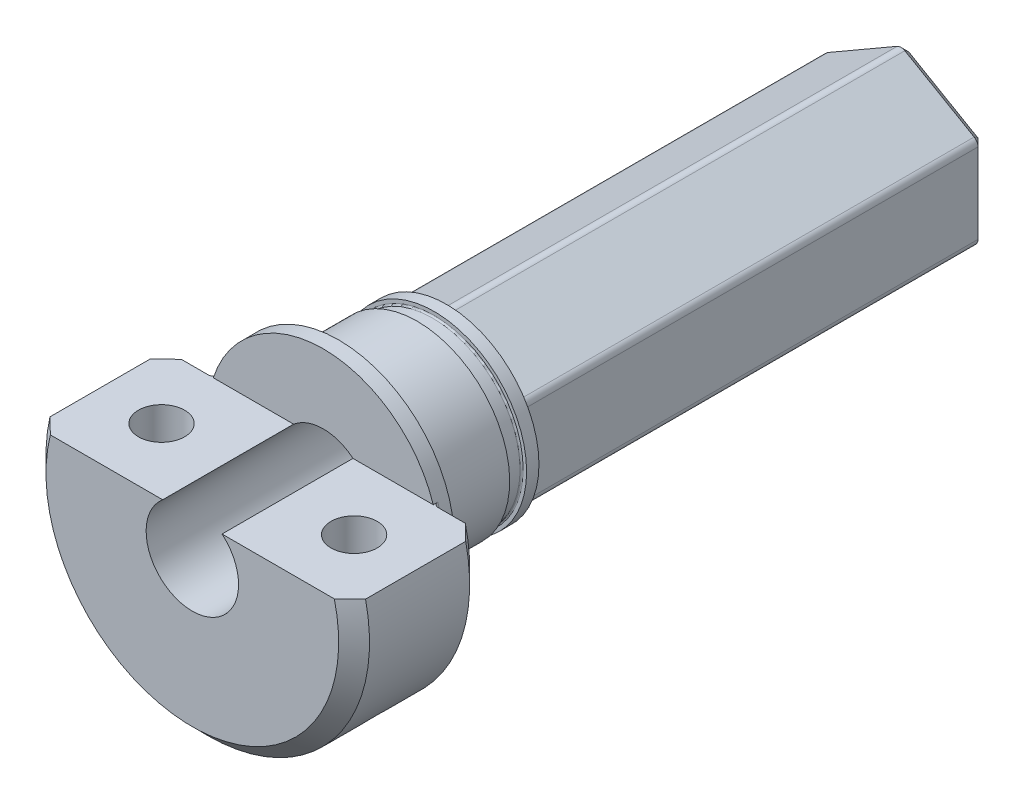
from build123d import *

# Parameters (mm, degrees)
SKETCH1_R             = 10.5
SKETCH1_R_2           = 3
EXTRUDE1_DEPTH        = 46.5
SKETCH1_3_R           = 3
CUT_EXTRUDE1_DEPTH    = 49.813420286
CUT_EXTRUDE4_DEPTH    = 8.5
CUT_EXTRUDE6_START    = -37
SKETCH6_R             = 10.5
SKETCH6_R_2           = 6
CUT_EXTRUDE6_DEPTH    = 37
CUT_EXTRUDE7_START    = -1
SKETCH7_R             = 10.5
SKETCH7_R_2           = 7.5
CUT_EXTRUDE7_DEPTH    = 1
M4X0_7_TAPPED_HOLE1_D = 3
SKETCH8_OUTSIDE_W     = 33.82
SKETCH8_OUTSIDE_H     = 30.82
CUT_EXTRUDE8_DEPTH    = 30
FILLET1_R             = 0.5
CHAMFER1_SIZE         = 0.5
FILLET2_R             = 0.3
CHAMFER2_SIZE         = 1


with BuildPart() as part:
    # Sketch1 → Extrude1 (new body)
    # profile 1 of 2: a face of its own
    with BuildSketch(Plane.XY):
        Circle(SKETCH1_R)
        Circle(SKETCH1_R_2, mode=Mode.SUBTRACT)
    # profile 2 of 2: a face of its own
    with BuildSketch(Plane.XY):
        Circle(SKETCH1_R_2)
    extrude(amount=-EXTRUDE1_DEPTH)

    # Sketch1<3> → Cut-Extrude1 (cut, through all)
    with BuildSketch(Plane.XY):
        Circle(SKETCH1_3_R)
    extrude(amount=-CUT_EXTRUDE1_DEPTH, mode=Mode.SUBTRACT)

    # Sketch4 → Cut-Extrude4 (cut)
    with BuildSketch(Plane.XY):
        with BuildLine():
            Line((-10.24499878, 2.3), (10.24499878, 2.3))
            ThreePointArc((10.24499878, 2.3), (0, 10.5), (-10.24499878, 2.3))
        make_face()
    extrude(amount=-CUT_EXTRUDE4_DEPTH, mode=Mode.SUBTRACT)

    # Sketch6 → Cut-Extrude6 (cut)
    with BuildSketch(Plane(origin=(0, 0, -46.5), x_dir=(1, 0, 0), z_dir=(0, 0, -1)).offset(CUT_EXTRUDE6_START)):
        Circle(SKETCH6_R)
        with Locations(Location((0, 0, 0), (0, 0, 270))):
            Circle(SKETCH6_R_2, mode=Mode.SUBTRACT)
    extrude(amount=CUT_EXTRUDE6_DEPTH, mode=Mode.SUBTRACT)

    # Sketch7 → Cut-Extrude7 (cut)
    with BuildSketch(Plane(origin=(0, 0, -9.5), x_dir=(1, 0, 0), z_dir=(0, 0, -1)).offset(CUT_EXTRUDE7_START)):
        Circle(SKETCH7_R)
        with Locations(Location((0, 0, 0), (0, 0, 270))):
            Circle(SKETCH7_R_2, mode=Mode.SUBTRACT)
    extrude(amount=CUT_EXTRUDE7_DEPTH, mode=Mode.SUBTRACT)

    # M4x0.7 Tapped Hole1 (through all)
    with Locations(Plane(origin=(6.25, 2.3, -4.25), x_dir=(0, 0, 1), z_dir=(0, 1, 0))):
        with Locations((0, 0), (0, -12.5)):
            Hole(M4X0_7_TAPPED_HOLE1_D / 2)

    # Sketch8 outside → Cut-Extrude8 (cut)
    with BuildSketch(Plane(origin=(0, 0, -46.5), x_dir=(1, 0, 0), z_dir=(0, 0, -1))):
        with Locations((0, 1.5)):
            Rectangle(SKETCH8_OUTSIDE_W, SKETCH8_OUTSIDE_H)
        Polygon((0, 5.773502692), (-5, 2.886751346), (-5, -2.886751346), (0, -5.773502692), (5, -2.886751346), (5, 2.886751346), align=None, mode=Mode.SUBTRACT)
    extrude(amount=-CUT_EXTRUDE8_DEPTH, mode=Mode.SUBTRACT)

    # Fillet1
    fillet1_edges = [part.edges().sort_by_distance(p)[0] for p in [
        (5, -2.886751346, -31.5),
        (5, 2.886751346, -31.5),
        (0, 5.773502692, -31.5),
        (-5, 2.886751346, -31.5),
        (-5, -2.886751346, -31.5),
        (0, -5.773502692, -31.5),
    ]]
    fillet(fillet1_edges, radius=FILLET1_R)

    # Chamfer1
    chamfer1_edges = [part.edges().sort_by_distance(p)[0] for p in [
        (-2.5, -4.330127019, -46.5),
        (2.5, -4.330127019, -46.5),
        (-5, 0, -46.5),
        (-2.5, 4.330127019, -46.5),
        (2.5, 4.330127019, -46.5),
        (5, 0, -46.5),
        (0, -5.696152423, -46.5),
        (4.933012702, -2.848076211, -46.5),
        (4.933012702, 2.848076211, -46.5),
        (0, 5.696152423, -46.5),
        (-4.933012702, 2.848076211, -46.5),
        (-4.933012702, -2.848076211, -46.5),
    ]]
    chamfer(chamfer1_edges, length=CHAMFER1_SIZE - 0.0001)  # a hair under: the kernel refuses the full size

    # Sketch12 → Groove for ANSI B27.7 - 3AM1-12, Basic External Retaining Ring1 (revolve, cut)
    with BuildSketch(Plane(origin=(0, 0, 19.370057685), x_dir=(0, 1, 0), z_dir=(-1, 0, 0))):
        with BuildLine():
            Line((5.775, 33.970057685), (7.275, 33.970057685))
            Line((7.275, 33.970057685), (7.275, 35.070057685))
            Line((7.275, 35.070057685), (5.775, 35.070057685))
            ThreePointArc((5.775, 35.070057685), (5.704289322, 35.040768363), (5.675, 34.970057685))
            Line((5.675, 34.970057685), (5.675, 34.070057685))
            ThreePointArc((5.675, 34.070057685), (5.704289322, 33.999347007), (5.775, 33.970057685))
        make_face()
    revolve(axis=Axis((0, 0, 69.359173663), (0, 0, -1)), mode=Mode.SUBTRACT)

    # Fillet2
    fillet2_edges = [part.edges().sort_by_distance(p)[0] for p in [
        (0, -6, -9.5),
        (0, -7.5, -8.5),
    ]]
    fillet(fillet2_edges, radius=FILLET2_R)

    # Chamfer2
    chamfer2_edges = [part.edges().sort_by_distance(p)[0] for p in [
        (0, -10.5, 0),
        (0, -10.5, -8.5),
    ]]
    chamfer(chamfer2_edges, length=CHAMFER2_SIZE)


solid = part.part
